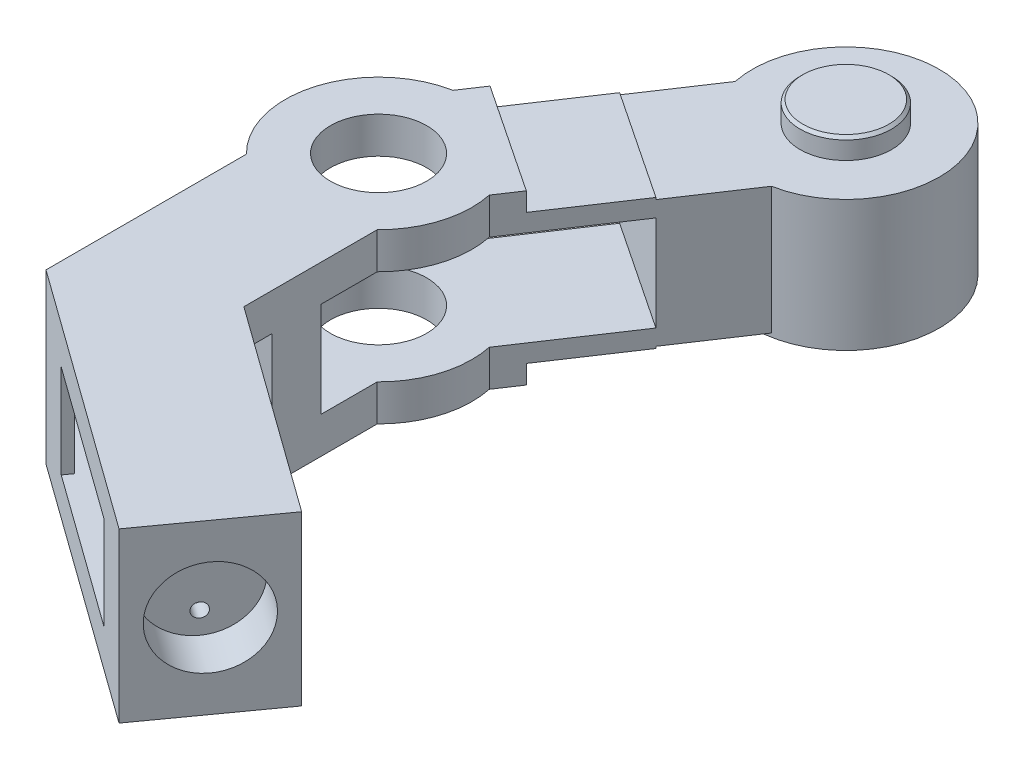
from build123d import *

# Parameters (mm, degrees)
EXTRUDE_1_DEPTH          = 6.8
SKETCH_2_R               = 10
EXTRUDE_1_2_DEPTH        = 14
EXTRUDE_2_DEPTH          = 9
CUT_EXTRUDE_1_DEPTH      = 5.1
SKETCH_5_R               = 4.9
EXTRUDE_3_DEPTH          = 15
SKETCH_6_R               = 5.15
CUT_EXTRUDE_5_DEPTH      = 20
CUT_EXTRUDE_8_DEPTH      = 5
CUT_EXTRUDE_8_DEPTH_BACK = 5
CUT_EXTRUDE_8_START      = -9
SKETCH_9_R               = 5.15
CUT_EXTRUDE_9_DEPTH      = 5
SKETCH_11_R              = 0.75
CUT_EXTRUDE_10_DEPTH     = 2
CUT_EXTRUDE_11_DEPTH     = 2
CUT_EXTRUDE_12_DEPTH     = 2
SKETCH_7_W               = 20.220207393
SKETCH_7_H               = 10
CUT_EXTRUDE_14_DEPTH     = 14
CHAMFER_C0_3_SIZE        = 0.3
SKETCH_19_R              = 4.9
EXTRUDE_9_8_2_2_DEPTH    = 2.2
CHAMFER_C0_3_2_SIZE      = 0.3


with BuildPart() as part:
    # 草图1 → Extrude 1 (new, symmetric)
    with BuildSketch(Plane(origin=(0, 0, 0), x_dir=(1, 0, 0), z_dir=(0, 1, 0))):
        Polygon((-5.82435206, 3.882901374), (-27, -27.880570536), (-27, -58.585636208), (0.909866919, -78.68074039), (9.090133081, -67.31925961), (-13, -51.414363792), (-13, -32.119429464), (5.82435206, -3.882901374), align=None)
    extrude(amount=EXTRUDE_1_DEPTH, both=True)

    # 草图2 → Extrude 1 2 (add)
    with BuildSketch(Plane(origin=(0, 6.8, 0), x_dir=(1, 0, 0), z_dir=(0, 1, 0))):
        Circle(SKETCH_2_R)
        with Locations((-20, -30)):
            Circle(SKETCH_2_R)
    extrude(amount=-EXTRUDE_1_2_DEPTH)

    # 草图3 → 凸台-拉伸2 (add, symmetric)
    with BuildSketch(Plane(origin=(0, 0, 0), x_dir=(1, 0, 0), z_dir=(0, 1, 0))):
        with BuildLine():
            Line((-3.081644015, -17.241895487), (-14.730348136, -9.47609274))
            Line((-14.730348136, -9.47609274), (-21.86300031, -20.175071))
            ThreePointArc((-21.86300031, -20.175071), (-29.570920265, -27.102158513), (-27, -37.141428429))
            Line((-27, -37.141428429), (-27, -58.585636208))
            Line((-27, -58.585636208), (0.909866919, -78.68074039))
            Line((0.909866919, -78.68074039), (9.090133081, -67.31925961))
            Line((9.090133081, -67.31925961), (-13, -51.414363792))
            Line((-13, -51.414363792), (-13, -37.141428429))
            ThreePointArc((-13, -37.141428429), (-10.429079735, -32.897841487), (-10.214296189, -27.940873748))
            Line((-10.214296189, -27.940873748), (-3.081644015, -17.241895487))
        make_face()
    extrude(amount=EXTRUDE_2_DEPTH, both=True)

    # 草图4 → 切除-拉伸1 (cut, symmetric)
    with BuildSketch(Plane(origin=(0, 0, 0), x_dir=(1, 0, 0), z_dir=(0, 1, 0))):
        with BuildLine():
            Line((-13, -37.141428429), (-13, -43.141428429))
            Line((-13, -43.141428429), (-27, -43.141428429))
            Line((-27, -43.141428429), (-27, -37.141428429))
            ThreePointArc((-27, -37.141428429), (-29.570920265, -27.102158513), (-21.86300031, -20.175071))
            Line((-21.86300031, -20.175071), (-14.730348136, -9.47609274))
            Line((-14.730348136, -9.47609274), (-3.081644015, -17.241895487))
            Line((-3.081644015, -17.241895487), (-10.214296189, -27.940873748))
            ThreePointArc((-10.214296189, -27.940873748), (-10.429079735, -32.897841487), (-13, -37.141428429))
        make_face()
    extrude(amount=CUT_EXTRUDE_1_DEPTH, both=True, mode=Mode.SUBTRACT)

    # 草图5 → 凸台-拉伸3 (add)
    with BuildSketch(Plane(origin=(0, 9, 0), x_dir=(1, 0, 0), z_dir=(0, 1, 0))):
        Circle(SKETCH_5_R)
    extrude(amount=-EXTRUDE_3_DEPTH)

    # 草图6 → 切除-拉伸5 (cut)
    with BuildSketch(Plane(origin=(0, 9, 0), x_dir=(1, 0, 0), z_dir=(0, 1, 0))):
        with Locations((-20, -30)):
            Circle(SKETCH_6_R)
    extrude(amount=-CUT_EXTRUDE_5_DEPTH, mode=Mode.SUBTRACT)

    # 草图8 → 切除-拉伸8 (cut, two sides: drawn at the far end of the back side and taken through both)
    with BuildSketch(Plane(origin=(0, 9, 0), x_dir=(1, 0, 0), z_dir=(0, 1, 0)).offset(CUT_EXTRUDE_8_START - CUT_EXTRUDE_8_DEPTH_BACK)):
        Polygon((3.409392691, -63.229126529), (-4.186568745, -73.779072968), (-26, -58.073402464), (-26, -48.414363792), (-13, -48.414363792), (-13, -51.414363792), align=None)
    extrude(amount=CUT_EXTRUDE_8_DEPTH + CUT_EXTRUDE_8_DEPTH_BACK, mode=Mode.SUBTRACT)

    # 草图9 → 切除-拉伸9 (cut)
    with BuildSketch(Plane(origin=(37.908324552, 0, 27.293993678), x_dir=(0.5843047258450756, 0, -0.8115343414514946), z_dir=(0.8115343414514946, 0, 0.5843047258450756))):
        with Locations((-56.320483297, 0)):
            Circle(SKETCH_9_R)
    extrude(amount=-CUT_EXTRUDE_9_DEPTH, mode=Mode.SUBTRACT)

    # 草图11 → 切除-拉伸10 (cut)
    with BuildSketch(Plane(origin=(33.850652845, 0, 24.372470048), x_dir=(0.5843047258450756, 0, -0.8115343414514947), z_dir=(0.8115343414514947, 0, 0.5843047258450756))):
        with Locations((-56.320483297, 2.8)):
            Circle(SKETCH_11_R)
        with Locations((-56.320483297, -2.8)):
            Circle(SKETCH_11_R)
    extrude(amount=-CUT_EXTRUDE_10_DEPTH, mode=Mode.SUBTRACT)

    # 草图12 → 切除-拉伸11 (cut)
    with BuildSketch(Plane(origin=(0, 9, 0), x_dir=(1, 0, 0), z_dir=(0, 1, 0))):
        Polygon((-14.730348136, -9.47609274), (-3.081644015, -17.241895487), (-8.628645977, -25.56239843), (-20.277350098, -17.796595683), align=None)
    extrude(amount=-CUT_EXTRUDE_11_DEPTH, mode=Mode.SUBTRACT)

    # 草图13 → 切除-拉伸12 (cut)
    with BuildSketch(Plane.XZ.offset(9)):
        Polygon((-14.730348136, 9.47609274), (-3.081644015, 17.241895487), (-8.628645977, 25.56239843), (-20.277350098, 17.796595683), align=None)
    extrude(amount=-CUT_EXTRUDE_12_DEPTH, mode=Mode.SUBTRACT)

    # 草图7 → 切除-拉伸14 (cut)
    with BuildSketch(Plane(origin=(-28.818191471, 0, 40.025265932), x_dir=(-0.8115343414514946, 0, -0.5843047258450756), z_dir=(0.5843047258450756, 0, -0.8115343414514946))):
        with Locations((-29.601812998, 0)):
            Rectangle(SKETCH_7_W, SKETCH_7_H)
    extrude(amount=-CUT_EXTRUDE_14_DEPTH, mode=Mode.SUBTRACT)

    # Chamfer C0.3
    chamfer_c0_3_edges = [part.edges().sort_by_distance(p)[0] for p in [
        (-4.9, 9, 0),
    ]]
    chamfer(chamfer_c0_3_edges, length=CHAMFER_C0_3_SIZE)

    # 草图19 → 另一侧圆柱_直径9.8_外伸2.2 (add)
    with BuildSketch(Plane.XZ.offset(7.2)):
        Circle(SKETCH_19_R)
    extrude(amount=EXTRUDE_9_8_2_2_DEPTH)

    # Chamfer C0.3 2
    chamfer_c0_3_2_edges = [part.edges().sort_by_distance(p)[0] for p in [
        (-4.9, -9.4, 0),
    ]]
    chamfer(chamfer_c0_3_2_edges, length=CHAMFER_C0_3_2_SIZE)


solid = part.part
